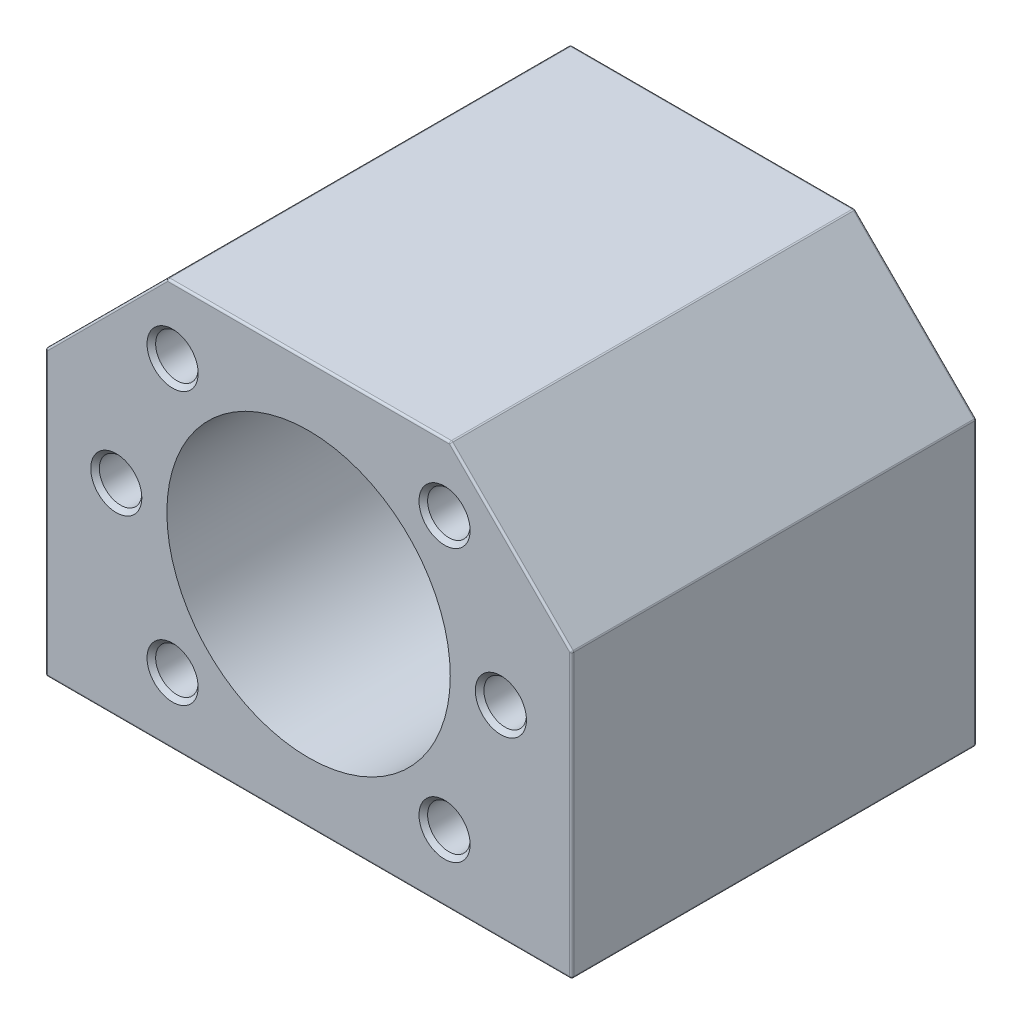
from build123d import *

# Parameters (mm, degrees)
ESQUISSE1_W              = 52
ESQUISSE1_H              = 40
ESQUISSE1_R              = 14
BOSS_EXTRU_1_DEPTH       = 40
CHANFREIN1_SIZE          = 12
CONG_1_R                 = 0.2
M5X0_81_D                = 4.2
M5X0_81_DEPTH            = 14
M5X0_81_CSINK_D          = 5.05
M5X0_81_CSINK_ANGLE      = 90
M5X0_81_TIP              = 1.2618073
M5X0_82_AT_2_COUNT       = 2
M5X0_82_AT_2_PITCH       = 38
PATTERN_CIRCULAR_1_COUNT = 2
PATTERN_CIRCULAR_1_ANGLE = 45
PATTERN_CIRCULAR_2_COUNT = 2
PATTERN_CIRCULAR_2_ANGLE = 315


with BuildPart() as part:
    # Esquisse1 → Boss.-Extru.1 (new body)
    with BuildSketch(Plane.XY):
        with Locations((26, 20)):
            Rectangle(ESQUISSE1_W, ESQUISSE1_H)
        with Locations((26, 20)):
            Circle(ESQUISSE1_R, mode=Mode.SUBTRACT)
    extrude(amount=BOSS_EXTRU_1_DEPTH)

    # Chanfrein1
    chanfrein1_edges = [part.edges().sort_by_distance(p)[0] for p in [
        (0, 40, 20),
        (52, 40, 20),
    ]]
    chamfer(chanfrein1_edges, length=CHANFREIN1_SIZE)

    # Congé1
    cong_1_edges = [part.edges().sort_by_distance(p)[0] for p in [
        (52, 14, 0),
        (46, 34, 0),
        (26, 40, 0),
        (6, 34, 0),
        (0, 14, 0),
        (52, 28, 20),
        (40, 40, 20),
        (12, 40, 20),
        (0, 28, 20),
        (6, 34, 40),
        (26, 40, 40),
        (46, 34, 40),
        (52, 14, 40),
        (52, 0, 20),
        (26, 0, 0),
        (0, 14, 40),
        (0, 0, 20),
        (26, 0, 40),
        (12, 20, 0),
    ]]
    fillet(cong_1_edges, radius=CONG_1_R)

    # Отверстие обработанное метчиком M5x0.81
    with Locations(Plane(origin=(0, 0, 0), x_dir=(-1, 0, 0), z_dir=(0, -1, 0))):
        with Locations((-6, -32), (-46, -32), (-46, -8), (-6, -8)):
            CounterSinkHole(M5X0_81_D / 2, M5X0_81_CSINK_D / 2, depth=M5X0_81_DEPTH, counter_sink_angle=M5X0_81_CSINK_ANGLE)
            with Locations((0, 0, -(M5X0_81_DEPTH + M5X0_81_TIP / 2))):  # 118° drill point
                Cone(0, M5X0_81_D / 2, M5X0_81_TIP, mode=Mode.SUBTRACT)

    # Эскиз6 → Отверстие обработанное метчиком M5x0.82 (revolve, cut)
    with BuildSketch(Plane(origin=(7, 20, 40), x_dir=(0, -1, 0), z_dir=(1, 0, 0))):
        Polygon((0, 0), (0, 15.2618073), (2.1, 14), (2.1, 0.425), (2.525, 0), align=None)
    m5x0_82 = revolve(axis=Axis((7, 20, 46.35), (0, 0, -1)), mode=Mode.SUBTRACT)

    # Отверстие обработанное метчиком M5x0.82 at 2: Отверстие обработанное метчиком M5x0.82 ×2
    with Locations(*[(i * M5X0_82_AT_2_PITCH, 0, 0) for i in range(1, M5X0_82_AT_2_COUNT)]):
        add(m5x0_82, mode=Mode.SUBTRACT)

    # Круговой массив1: Отверстие обработанное метчиком M5x0.82 ×2 about axis
    pattern_circular_1_axis = Axis((26, 20, 40), (0, 0, 1))
    for i in range(1, PATTERN_CIRCULAR_1_COUNT):
        add(m5x0_82.rotate(pattern_circular_1_axis, i * PATTERN_CIRCULAR_1_ANGLE / (PATTERN_CIRCULAR_1_COUNT - 1)), mode=Mode.SUBTRACT)

    # Круговой массив1 copy 1 sketch → Круговой массив1 copy 1 (revolve, cut)
    with BuildSketch(Plane(origin=(39.435028843, 33.435028843, 40), x_dir=(0.7071067811865488, -0.7071067811865462, 0), z_dir=(0.7071067811865462, 0.7071067811865488, 0))):
        Polygon((0, 0), (0, 15.2618073), (2.1, 14), (2.1, 0.425), (2.525, 0), align=None)
    revolve(axis=Axis((39.435028843, 33.435028843, 46.35), (0, 0, -1)), mode=Mode.SUBTRACT)

    # Круговой массив2: Отверстие обработанное метчиком M5x0.82 ×2 about axis
    pattern_circular_2_axis = Axis((26, 20, 40), (0, 0, 1))
    for i in range(1, PATTERN_CIRCULAR_2_COUNT):
        add(m5x0_82.rotate(pattern_circular_2_axis, i * PATTERN_CIRCULAR_2_ANGLE / (PATTERN_CIRCULAR_2_COUNT - 1)), mode=Mode.SUBTRACT)

    # Круговой массив2 copy 1 sketch → Круговой массив2 copy 1 (revolve, cut)
    with BuildSketch(Plane(origin=(39.435028843, 6.564971157, 40), x_dir=(-0.7071067811865389, -0.7071067811865561, 0), z_dir=(0.7071067811865561, -0.7071067811865389, 0))):
        Polygon((0, 0), (0, 15.2618073), (2.1, 14), (2.1, 0.425), (2.525, 0), align=None)
    revolve(axis=Axis((39.435028843, 6.564971157, 46.35), (0, 0, -1)), mode=Mode.SUBTRACT)


solid = part.part
